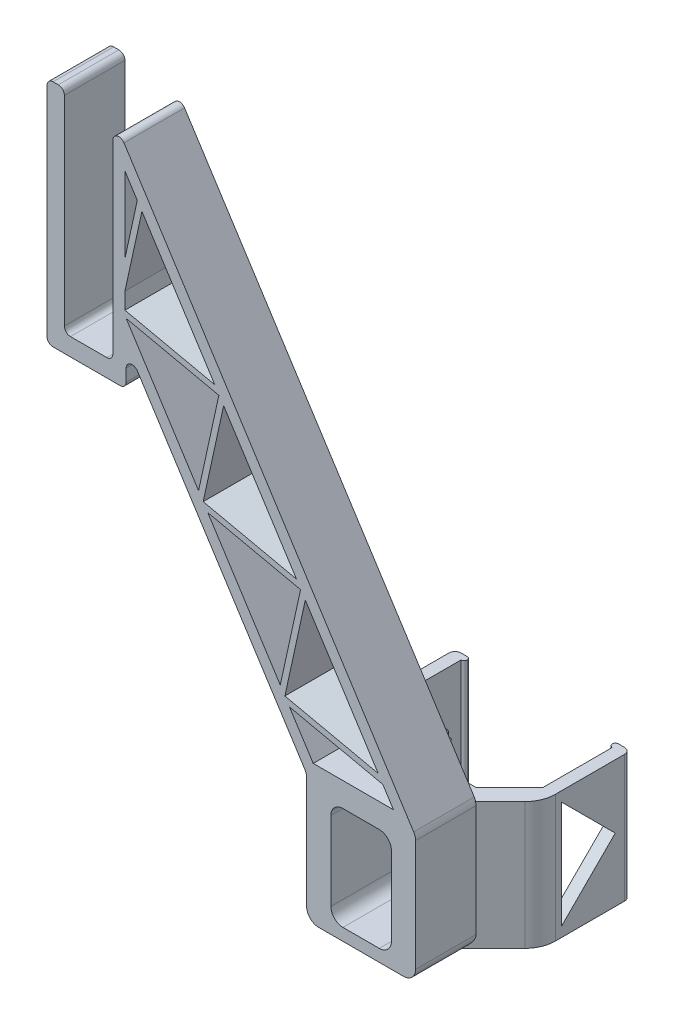
from build123d import *

# Parameters (mm, degrees)
BOSS_EXTRUDE2_DEPTH  = 21
FILLET1_R            = 5
SKETCH4_R            = 0.5
BOSS_EXTRUDE3_DEPTH  = 21
SKETCH5_R            = 0.5
BOSS_EXTRUDE4_DEPTH  = 21
FILLET2_R            = 1
BOSS_EXTRUDE5_DEPTH  = 1.5
FILLET3_R            = 1
FILLET4_R            = 1
SKETCH7_R            = 0.5
BOSS_EXTRUDE6_DEPTH  = 3
SKETCH8_W            = 3
SKETCH8_H            = 7
BOSS_EXTRUDE7_DEPTH  = 1.5
FILLET5_R            = 1
SKETCH9_R            = 0.5
BOSS_EXTRUDE8_DEPTH  = 3
SKETCH10_W           = 10
SKETCH10_H           = 17
CUT_EXTRUDE1_DEPTH   = 36.951356024
CUT_EXTRUDE2_DEPTH   = 41.880924647
SKETCH12_W           = 18
SKETCH12_H           = 21
SKETCH12_W_2         = 10
SKETCH12_H_2         = 17
BOSS_EXTRUDE9_DEPTH  = 10
BOSS_EXTRUDE10_DEPTH = 10
BOSS_EXTRUDE14_DEPTH = 10
BOSS_EXTRUDE15_DEPTH = 10
LPATTERN1_START      = 2
LPATTERN1_DEPTH      = 10
SKETCH17_W           = 2.875504222
SKETCH17_H           = 35
BOSS_EXTRUDE16_DEPTH = 10
BOSS_EXTRUDE17_DEPTH = 10
FILLET6_R            = 1
FILLET7_R            = 1
FILLET8_R            = 1
FILLET9_R            = 2


# Read off the part's stored shape, not the designer's step: LPattern1
with BuildPart() as part:
    # Sketch3 → Boss-Extrude2 (new body)
    with BuildSketch(Plane(origin=(0, 0, 0), x_dir=(1, 0, 0), z_dir=(0, 1, 0))):
        Polygon((0, 0), (-5.5, 5.5), (-5.5, 18), (-7.5, 18), (-7.5, 3.5), (-2, -2), (16, -2), (21.5, 3.5), (21.5, 18), (19.5, 18), (19.5, 5.5), (14, 0), align=None)
    extrude(amount=BOSS_EXTRUDE2_DEPTH)

    # Fillet1
    fillet1_edges = [part.edges().sort_by_distance(p)[0] for p in [
        (-7.5, 10.5, -3.5),
        (21.5, 10.5, -3.5),
    ]]
    fillet(fillet1_edges, radius=FILLET1_R)

    # Sketch4 → Boss-Extrude3 (add)
    with BuildSketch(Plane(origin=(0, 21, 0), x_dir=(1, 0, 0), z_dir=(0, 1, 0))):
        with Locations((-5.5, 17.5)):
            Circle(SKETCH4_R)
    extrude(amount=-BOSS_EXTRUDE3_DEPTH)

    # Sketch5 → Boss-Extrude4 (add)
    with BuildSketch(Plane(origin=(0, 21, 0), x_dir=(1, 0, 0), z_dir=(0, 1, 0))):
        with Locations((19.5, 17.5)):
            Circle(SKETCH5_R)
    extrude(amount=-BOSS_EXTRUDE4_DEPTH)

    # Fillet2
    fillet2_edges = [part.edges().sort_by_distance(p)[0] for p in [
        (-7.5, 10.5, -18),
        (21.5, 10.5, -18),
    ]]
    fillet(fillet2_edges, radius=FILLET2_R)

    # Sketch6 → Boss-Extrude5 (add)
    with BuildSketch(Plane(origin=(0, 21, 0), x_dir=(1, 0, 0), z_dir=(0, 1, 0))):
        Polygon((1.451426333, 5), (1.451426333, 0), (1.451426333, -2), (4.451426333, -2), (4.451426333, 0), (4.451426333, 5), align=None)
    extrude(amount=BOSS_EXTRUDE5_DEPTH)

    # Fillet3
    fillet3_edges = [part.edges().sort_by_distance(p)[0] for p in [
        (2.951426333, 22.5, 2),
    ]]
    fillet(fillet3_edges, radius=FILLET3_R)

    # Fillet4
    fillet4_edges = [part.edges().sort_by_distance(p)[0] for p in [
        (2.951426333, 22.5, -5),
    ]]
    fillet(fillet4_edges, radius=FILLET4_R)

    # Sketch7 → Boss-Extrude6 (add)
    with BuildSketch(Plane.ZY.offset(-1.451426333)):
        with Locations((-4.5, 21)):
            Circle(SKETCH7_R)
    extrude(amount=-BOSS_EXTRUDE6_DEPTH)

    # Sketch8 → Boss-Extrude7 (add)
    with BuildSketch(Plane.XZ):
        with Locations((2.951426333, -1.5)):
            Rectangle(SKETCH8_W, SKETCH8_H)
    extrude(amount=BOSS_EXTRUDE7_DEPTH)

    # Fillet5
    fillet5_edges = [part.edges().sort_by_distance(p)[0] for p in [
        (2.951426333, -1.5, -5),
        (2.951426333, -1.5, 2),
    ]]
    fillet(fillet5_edges, radius=FILLET5_R)

    # Sketch9 → Boss-Extrude8 (add)
    with BuildSketch(Plane(origin=(4.451426333, 0, 0), x_dir=(0, 0, -1), z_dir=(1, 0, 0))):
        with Locations((4.5, 0)):
            Circle(SKETCH9_R)
    extrude(amount=-BOSS_EXTRUDE8_DEPTH)

    # Sketch10 → Cut-Extrude1 (cut, through all)
    with BuildSketch(Plane(origin=(0, 0, 0), x_dir=(-1, 0, 0), z_dir=(0, 0, -1))):
        with Locations((-7, 10.5)):
            Rectangle(SKETCH10_W, SKETCH10_H)
    extrude(amount=-CUT_EXTRUDE1_DEPTH, mode=Mode.SUBTRACT)

    # Sketch11 → Cut-Extrude2 (cut, through all)
    with BuildSketch(Plane.ZY.offset(7.5)):
        Polygon((-6.571067812, 19.4), (-6.571067812, 1.604815424), (-15.4686601, 10.502407712), align=None)
    extrude(amount=-CUT_EXTRUDE2_DEPTH, mode=Mode.SUBTRACT)

    # Sketch12 → Boss-Extrude9 (add)
    with BuildSketch(Plane.XY.offset(2)):
        with Locations((7, 10.5)):
            Rectangle(SKETCH12_W, SKETCH12_H)
        with Locations((7, 10.5)):
            Rectangle(SKETCH12_W_2, SKETCH12_H_2, mode=Mode.SUBTRACT)
    extrude(amount=BOSS_EXTRUDE9_DEPTH)

    # Sketch13 → Boss-Extrude10 (add)
    with BuildSketch(Plane.XY.offset(12)):
        Polygon((16, 21), (-34, 99), (-34, 70.921750355), (-2, 21), align=None)
        Polygon((-0.906392677, 23), (-32, 71.507728201), (-32, 92.174004857), (12.342310806, 23), align=None, mode=Mode.SUBTRACT)
    extrude(amount=-BOSS_EXTRUDE10_DEPTH)

    # Sketch14 → Boss-Extrude14 (add)
    with BuildSketch(Plane.XY.offset(12)):
        Polygon((10.585384641, 25.740804817), (-4.823944827, 29.111595638), (-6.748576082, 29.532608725), (-6.534879203, 30.509508743), (-4.610247948, 30.088495656), (10.79908152, 26.717704835), align=None)
    extrude(amount=-BOSS_EXTRUDE14_DEPTH)

    # Sketch16 → Boss-Extrude15 (add)
    with BuildSketch(Plane.XY.offset(12)):
        Polygon((-5.587116842, 30.302185726), (-2.216332829, 45.71148407), (-2.025604345, 46.583385709), (-1.775197733, 47.728101652), (-2.75209775, 47.941798531), (-3.002504363, 46.797082588), (-3.193232846, 45.925180949), (-6.564016859, 30.515882605), align=None)
    extrude(amount=-BOSS_EXTRUDE15_DEPTH)

    # LPattern1 outline → LPattern1 (add)
    with BuildSketch(Plane.XY.offset(LPATTERN1_START)):
        Polygon((-2.979535968, 46.902080966), (-3.669471366, 47.978380187), (-19.078219518, 51.349043846), (-18.315047503, 50.158453758), (-3.000050935, 46.808298259), align=None)
        Polygon((-19.078649352, 51.349714409), (-15.707985697, 66.758462544), (-17.161124234, 69.025358662), (-32, 72.271362735), (-32, 71.507728201), (-31.80615018, 71.205311878), (-16.491703803, 67.855276733), (-19.841845682, 52.54034243), align=None)
        Polygon((-32, 75.003788744), (-29.199638565, 87.805441018), (-29.962841704, 88.996037915), (-32, 79.683314274), align=None)
    extrude(amount=LPATTERN1_DEPTH)



with BuildPart() as body_2:
    # Sketch17 → Boss-Extrude16 (new body)
    with BuildSketch(Plane.XY.offset(12)):
        with Locations((-43.437752111, 81.5)):
            Rectangle(SKETCH17_W, SKETCH17_H)
    extrude(amount=-BOSS_EXTRUDE16_DEPTH)


with BuildPart() as part_1:
    add(part.part)

    add(body_2.part)  # Boss-Extrude17 merges body 2
    # Sketch18 → Boss-Extrude17 (add)
    with BuildSketch(Plane.XY.offset(12)):
        Polygon((-34, 64), (-34, 71.035157721), (-31.80615018, 71.205311878), (-31.80615018, 61.08148926), (-34, 61.08148926), (-44.875504222, 61.08148926), (-44.875504222, 64), (-42, 64), align=None)
    extrude(amount=-BOSS_EXTRUDE17_DEPTH)

    # Fillet6
    fillet6_edges = [part_1.edges().sort_by_distance(p)[0] for p in [
        (-31.80615018, 67.499224635, 7),
    ]]
    fillet(fillet6_edges, radius=FILLET6_R)

    # Fillet7
    fillet7_edges = [part_1.edges().sort_by_distance(p)[0] for p in [
        (-34, 99, 7),
        (-44.875504222, 61.08148926, 7),
        (-31.80615018, 61.08148926, 7),
        (-42, 99, 7),
        (-44.875504222, 99, 7),
    ]]
    fillet(fillet7_edges, radius=FILLET7_R)

    # Fillet8
    fillet8_edges = [part_1.edges().sort_by_distance(p)[0] for p in [
        (-34, 64, 7),
        (-42, 64, 7),
    ]]
    fillet(fillet8_edges, radius=FILLET8_R)

    # Fillet9
    fillet9_edges = [part_1.edges().sort_by_distance(p)[0] for p in [
        (2, 19, 6),
        (2, 2, 6),
        (12, 2, 6),
        (12, 19, 6),
        (16, 0, 7),
        (16, 21, 7),
        (-2, 21, 7),
        (-2, 0, 7),
    ]]
    fillet(fillet9_edges, radius=FILLET9_R)


solid = part_1.part
